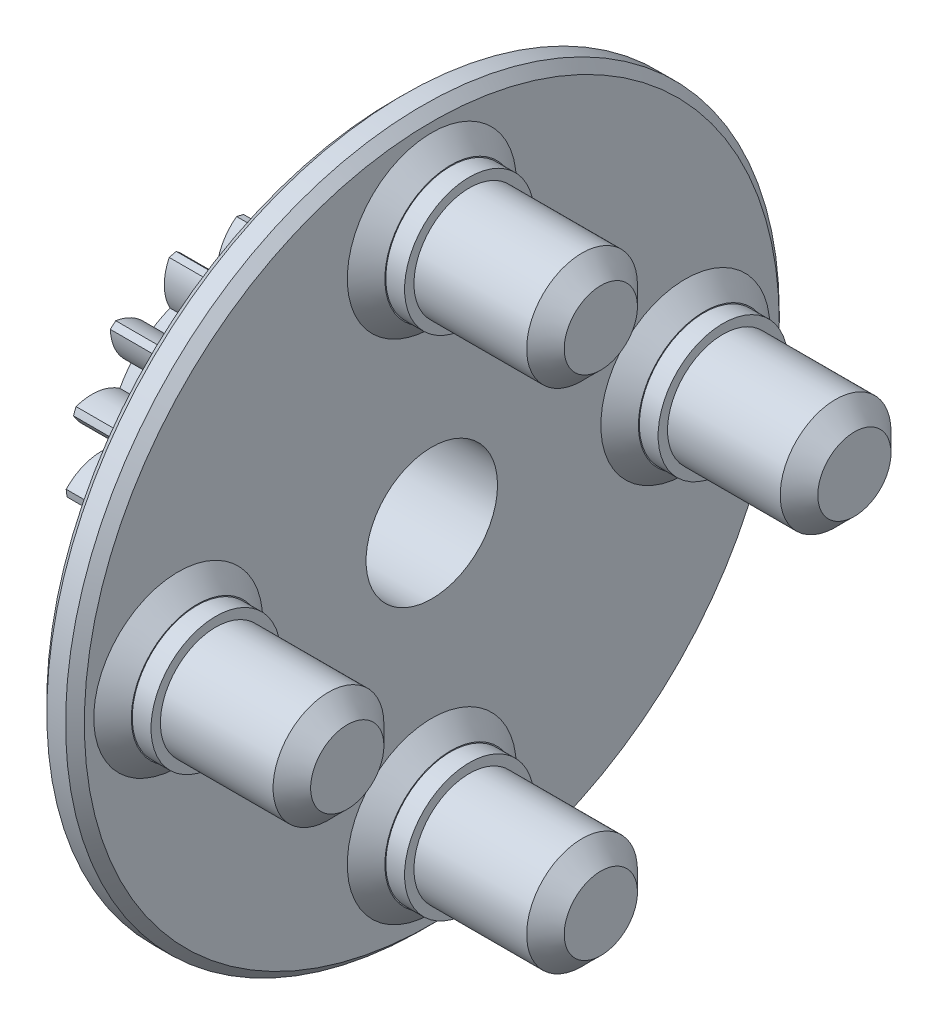
from build123d import *

# Parameters (mm, degrees)
BOSS_EXTRUDE1_OUTLINE_R   = 19
BOSS_EXTRUDE1_DEPTH       = 2
BOSS_EXTRUDE1_START       = -8
BOSS_EXTRUDE1_2_OUTLINE_R = 2.5
BOSS_EXTRUDE1_2_DEPTH     = 8
SKETCH2_R                 = 3.5
CUT_EXTRUDE1_DEPTH        = 29.670542374
SKETCH3_R                 = 2.95
BOSS_EXTRUDE2_DEPTH       = 9
BOSS_EXTRUDE3_START       = 2
SKETCH5_R                 = 3.5
BOSS_EXTRUDE3_DEPTH       = 2
SKETCH6_R                 = 4.5
BOSS_EXTRUDE4_DEPTH       = 1
SKETCH7_R                 = 3.45
BOSS_EXTRUDE5_DEPTH       = 1
CHAMFER3_SIZE             = 1
CHAMFER4_SIZE             = 1
CHAMFER5_SIZE             = 0.5
SKETCH8_R                 = 3.065
BOSS_EXTRUDE6_DEPTH       = 1
CHAMFER7_SIZE             = 0.1
CUT_EXTRUDE2_START        = -5
SKETCH9_R                 = 3.929046374
SKETCH9_R_2               = 2.95
CUT_EXTRUDE2_DEPTH        = 5


with BuildPart() as part:
    # Boss-Extrude1: read off the stored shape, not the designer's step
    # Boss-Extrude1 outline → Boss-Extrude1 (new body)
    with BuildSketch(Plane(origin=(8, 0, 0), x_dir=(0, 0, -1), z_dir=(1, 0, 0))):
        Circle(BOSS_EXTRUDE1_OUTLINE_R)
    extrude(amount=BOSS_EXTRUDE1_DEPTH)

    # Boss-Extrude1 2 outline → Boss-Extrude1 2 (add)
    with BuildSketch(Plane(origin=(8, 0, 0), x_dir=(0, 0, -1), z_dir=(1, 0, 0)).offset(BOSS_EXTRUDE1_START)):
        with BuildLine():
            ThreePointArc((-4.827976462, 5.739393982), (-4.973419937, 5.613830611), (-5.115599083, 5.484582575))
            ThreePointArc((-5.115599083, 5.484582575), (-4.796933675, 4.315856884), (-3.983306334, 3.41837266))
            ThreePointArc((-3.983306334, 3.41837266), (-4.319842312, 2.981771856), (-4.608733854, 2.512284471))
            ThreePointArc((-4.608733854, 2.512284471), (-5.736412412, 2.954786958), (-6.942190227, 2.838308449))
            ThreePointArc((-6.942190227, 2.838308449), (-7.01262182, 2.659536653), (-7.078450644, 2.479019256))
            ThreePointArc((-7.078450644, 2.479019256), (-6.253152528, 1.592255251), (-5.115639582, 1.175683915))
            ThreePointArc((-5.115639582, 1.175683915), (-5.21072888, 0.632697034), (-5.24834797, 0.082732007))
            ThreePointArc((-5.24834797, 0.082732007), (-6.452498904, -0.049509856), (-7.466031873, -0.712999344))
            ThreePointArc((-7.466031873, -0.712999344), (-7.445316556, -0.904025102), (-7.419714468, -1.094457498))
            ThreePointArc((-7.419714468, -1.094457498), (-6.276849497, -1.496112872), (-5.076041451, -1.336339847))
            ThreePointArc((-5.076041451, -1.336339847), (-4.907900258, -1.861321052), (-4.685628816, -2.365773362))
            ThreePointArc((-4.685628816, -2.365773362), (-5.690395658, -3.042464558), (-6.279495593, -4.10096758))
            ThreePointArc((-6.279495593, -4.10096758), (-6.172378994, -4.2604856), (-6.061211124, -4.41720723))
            ThreePointArc((-6.061211124, -4.41720723), (-4.862595889, -4.241739566), (-3.873583397, -3.542224254))
            ThreePointArc((-3.873583397, -3.542224254), (-3.480730833, -3.928932917), (-3.049488568, -4.272308565))
            ThreePointArc((-3.049488568, -4.272308565), (-3.624691343, -5.338427296), (-3.654402549, -6.549453566))
            ThreePointArc((-3.654402549, -6.549453566), (-3.48542379, -6.640920192), (-3.314157357, -6.728028018))
            ThreePointArc((-3.314157357, -6.728028018), (-2.334380164, -6.015634844), (-1.783734068, -4.936627773))
            ThreePointArc((-1.783734068, -4.936627773), (-1.256167922, -5.0964736), (-0.714747239, -5.200109363))
            ThreePointArc((-0.714747239, -5.200109363), (-0.728613924, -6.411420676), (-0.192129921, -7.497538669))
            ThreePointArc((-0.192129921, -7.497538669), (0, -7.5), (0.192129921, -7.497538669))
            ThreePointArc((0.192129921, -7.497538669), (0.728613924, -6.411420676), (0.714747239, -5.200109363))
            ThreePointArc((0.714747239, -5.200109363), (1.256167922, -5.0964736), (1.783734068, -4.936627773))
            ThreePointArc((1.783734068, -4.936627773), (2.334380164, -6.015634844), (3.314157357, -6.728028018))
            ThreePointArc((3.314157357, -6.728028018), (3.48542379, -6.640920192), (3.654402549, -6.549453566))
            ThreePointArc((3.654402549, -6.549453566), (3.624691343, -5.338427296), (3.049488568, -4.272308565))
            ThreePointArc((3.049488568, -4.272308565), (3.480730833, -3.928932917), (3.873583397, -3.542224254))
            ThreePointArc((3.873583397, -3.542224254), (4.862595889, -4.241739566), (6.061211124, -4.41720723))
            ThreePointArc((6.061211124, -4.41720723), (6.172378994, -4.2604856), (6.279495593, -4.10096758))
            ThreePointArc((6.279495593, -4.10096758), (5.690395658, -3.042464558), (4.685628816, -2.365773362))
            ThreePointArc((4.685628816, -2.365773362), (4.907900258, -1.861321052), (5.076041451, -1.336339847))
            ThreePointArc((5.076041451, -1.336339847), (6.276849497, -1.496112872), (7.419714468, -1.094457498))
            ThreePointArc((7.419714468, -1.094457498), (7.445316556, -0.904025102), (7.466031873, -0.712999344))
            ThreePointArc((7.466031873, -0.712999344), (6.452498904, -0.049509856), (5.24834797, 0.082732007))
            ThreePointArc((5.24834797, 0.082732007), (5.21072888, 0.632697034), (5.115639582, 1.175683915))
            ThreePointArc((5.115639582, 1.175683915), (6.253152528, 1.592255251), (7.078450644, 2.479019256))
            ThreePointArc((7.078450644, 2.479019256), (7.01262182, 2.659536653), (6.942190227, 2.838308449))
            ThreePointArc((6.942190227, 2.838308449), (5.736412412, 2.954786958), (4.608733854, 2.512284471))
            ThreePointArc((4.608733854, 2.512284471), (4.319842312, 2.981771856), (3.983306334, 3.41837266))
            ThreePointArc((3.983306334, 3.41837266), (4.796933675, 4.315856884), (5.115599083, 5.484582575))
            ThreePointArc((5.115599083, 5.484582575), (4.973419937, 5.613830611), (4.827976462, 5.739393982))
            ThreePointArc((4.827976462, 5.739393982), (3.706182968, 5.282177689), (2.913314353, 4.366302839))
            ThreePointArc((2.913314353, 4.366302839), (2.43933193, 4.647758679), (1.93844561, 4.877953425))
            ThreePointArc((1.93844561, 4.877953425), (2.241795126, 6.050747718), (1.980825421, 7.233694122))
            ThreePointArc((1.980825421, 7.233694122), (1.794867482, 7.282063631), (1.607731473, 7.325653521))
            ThreePointArc((1.607731473, 7.325653521), (0.82691167, 6.399485168), (0.550489643, 5.220053846))
            ThreePointArc((0.550489643, 5.220053846), (0, 5.249), (-0.550489643, 5.220053846))
            ThreePointArc((-0.550489643, 5.220053846), (-0.82691167, 6.399485168), (-1.607731473, 7.325653521))
            ThreePointArc((-1.607731473, 7.325653521), (-1.794867482, 7.282063631), (-1.980825421, 7.233694122))
            ThreePointArc((-1.980825421, 7.233694122), (-2.241795126, 6.050747718), (-1.93844561, 4.877953425))
            ThreePointArc((-1.93844561, 4.877953425), (-2.43933193, 4.647758679), (-2.913314353, 4.366302839))
            ThreePointArc((-2.913314353, 4.366302839), (-3.706182968, 5.282177689), (-4.827976462, 5.739393982))
        make_face()
        Circle(BOSS_EXTRUDE1_2_OUTLINE_R, mode=Mode.SUBTRACT)
    extrude(amount=BOSS_EXTRUDE1_2_DEPTH)

    # Sketch2 → Cut-Extrude1 (cut, through all)
    with BuildSketch(Plane(origin=(10, 0, 0), x_dir=(0, 0, -1), z_dir=(1, 0, 0))):
        Circle(SKETCH2_R)
    extrude(amount=-CUT_EXTRUDE1_DEPTH, mode=Mode.SUBTRACT)

    # Sketch3 → Boss-Extrude2 (add)
    with BuildSketch(Plane(origin=(10, 0, 0), x_dir=(0, 0, -1), z_dir=(1, 0, 0))):
        with Locations((-13.5, 0)):
            Circle(SKETCH3_R)
        with Locations((0, 13.5)):
            Circle(SKETCH3_R)
        with Locations((13.5, 0)):
            Circle(SKETCH3_R)
        with Locations((0, -13.5)):
            Circle(SKETCH3_R)
    extrude(amount=BOSS_EXTRUDE2_DEPTH)

    # Sketch5 → Boss-Extrude3 (add)
    with BuildSketch(Plane.ZY.offset(BOSS_EXTRUDE3_START)):
        with BuildLine():
            ThreePointArc((3.983306334, 3.41837266), (4.796933675, 4.315856884), (5.115599083, 5.484582575))
            ThreePointArc((5.115599083, 5.484582575), (4.973419937, 5.613830611), (4.827976462, 5.739393982))
            ThreePointArc((4.827976462, 5.739393982), (3.706182968, 5.282177689), (2.913314353, 4.366302839))
            ThreePointArc((2.913314353, 4.366302839), (2.43933193, 4.647758679), (1.93844561, 4.877953425))
            ThreePointArc((1.93844561, 4.877953425), (2.241795126, 6.050747718), (1.980825421, 7.233694122))
            ThreePointArc((1.980825421, 7.233694122), (1.794867482, 7.282063631), (1.607731473, 7.325653521))
            ThreePointArc((1.607731473, 7.325653521), (0.82691167, 6.399485168), (0.550489643, 5.220053846))
            ThreePointArc((0.550489643, 5.220053846), (0, 5.249), (-0.550489643, 5.220053846))
            ThreePointArc((-0.550489643, 5.220053846), (-0.82691167, 6.399485168), (-1.607731473, 7.325653521))
            ThreePointArc((-1.607731473, 7.325653521), (-1.794867482, 7.282063631), (-1.980825421, 7.233694122))
            ThreePointArc((-1.980825421, 7.233694122), (-2.241795126, 6.050747718), (-1.93844561, 4.877953425))
            ThreePointArc((-1.93844561, 4.877953425), (-2.43933193, 4.647758679), (-2.913314353, 4.366302839))
            ThreePointArc((-2.913314353, 4.366302839), (-3.706182968, 5.282177689), (-4.827976462, 5.739393982))
            ThreePointArc((-4.827976462, 5.739393982), (-4.973419937, 5.613830611), (-5.115599083, 5.484582575))
            ThreePointArc((-5.115599083, 5.484582575), (-4.796933675, 4.315856884), (-3.983306334, 3.41837266))
            ThreePointArc((-3.983306334, 3.41837266), (-4.319842312, 2.981771856), (-4.608733854, 2.512284471))
            ThreePointArc((-4.608733854, 2.512284471), (-5.736412412, 2.954786958), (-6.942190227, 2.838308449))
            ThreePointArc((-6.942190227, 2.838308449), (-7.01262182, 2.659536653), (-7.078450644, 2.479019256))
            ThreePointArc((-7.078450644, 2.479019256), (-6.253152529, 1.592255251), (-5.115639582, 1.175683915))
            ThreePointArc((-5.115639582, 1.175683915), (-5.21072888, 0.632697035), (-5.24834797, 0.082732007))
            ThreePointArc((-5.24834797, 0.082732007), (-6.452498904, -0.049509856), (-7.466031873, -0.712999344))
            ThreePointArc((-7.466031873, -0.712999344), (-7.445316556, -0.904025102), (-7.419714468, -1.094457498))
            ThreePointArc((-7.419714468, -1.094457498), (-6.276849497, -1.496112872), (-5.076041451, -1.336339847))
            ThreePointArc((-5.076041451, -1.336339847), (-4.907900258, -1.861321052), (-4.685628816, -2.365773362))
            ThreePointArc((-4.685628816, -2.365773362), (-5.690395658, -3.042464558), (-6.279495593, -4.10096758))
            ThreePointArc((-6.279495593, -4.10096758), (-6.172378994, -4.2604856), (-6.061211124, -4.41720723))
            ThreePointArc((-6.061211124, -4.41720723), (-4.862595889, -4.241739566), (-3.873583397, -3.542224254))
            ThreePointArc((-3.873583397, -3.542224254), (-3.480730833, -3.928932917), (-3.049488568, -4.272308565))
            ThreePointArc((-3.049488568, -4.272308565), (-3.624691343, -5.338427296), (-3.654402549, -6.549453566))
            ThreePointArc((-3.654402549, -6.549453566), (-3.48542379, -6.640920192), (-3.314157357, -6.728028018))
            ThreePointArc((-3.314157357, -6.728028018), (-2.334380164, -6.015634844), (-1.783734068, -4.936627773))
            ThreePointArc((-1.783734068, -4.936627773), (-1.256167922, -5.0964736), (-0.714747239, -5.200109363))
            ThreePointArc((-0.714747239, -5.200109363), (-0.728613924, -6.411420676), (-0.192129921, -7.497538669))
            ThreePointArc((-0.192129921, -7.497538669), (0, -7.5), (0.192129921, -7.497538669))
            ThreePointArc((0.192129921, -7.497538669), (0.728613924, -6.411420676), (0.714747239, -5.200109363))
            ThreePointArc((0.714747239, -5.200109363), (1.256167922, -5.0964736), (1.783734068, -4.936627773))
            ThreePointArc((1.783734068, -4.936627773), (2.334380164, -6.015634844), (3.314157357, -6.728028018))
            ThreePointArc((3.314157357, -6.728028018), (3.48542379, -6.640920192), (3.654402549, -6.549453566))
            ThreePointArc((3.654402549, -6.549453566), (3.624691343, -5.338427296), (3.049488568, -4.272308565))
            ThreePointArc((3.049488568, -4.272308565), (3.480730833, -3.928932917), (3.873583397, -3.542224254))
            ThreePointArc((3.873583397, -3.542224254), (4.862595889, -4.241739566), (6.061211124, -4.41720723))
            ThreePointArc((6.061211124, -4.41720723), (6.172378994, -4.2604856), (6.279495593, -4.10096758))
            ThreePointArc((6.279495593, -4.10096758), (5.690395658, -3.042464558), (4.685628816, -2.365773362))
            ThreePointArc((4.685628816, -2.365773362), (4.907900258, -1.861321052), (5.076041451, -1.336339847))
            ThreePointArc((5.076041451, -1.336339847), (6.276849497, -1.496112872), (7.419714468, -1.094457498))
            ThreePointArc((7.419714468, -1.094457498), (7.445316556, -0.904025102), (7.466031873, -0.712999344))
            ThreePointArc((7.466031873, -0.712999344), (6.452498904, -0.049509856), (5.24834797, 0.082732007))
            ThreePointArc((5.24834797, 0.082732007), (5.21072888, 0.632697035), (5.115639582, 1.175683915))
            ThreePointArc((5.115639582, 1.175683915), (6.253152529, 1.592255251), (7.078450644, 2.479019256))
            ThreePointArc((7.078450644, 2.479019256), (7.01262182, 2.659536653), (6.942190227, 2.838308449))
            ThreePointArc((6.942190227, 2.838308449), (5.736412412, 2.954786958), (4.608733854, 2.512284471))
            ThreePointArc((4.608733854, 2.512284471), (4.319842312, 2.981771856), (3.983306334, 3.41837266))
        make_face()
        with Locations(Location((0, 0, 0), (0, 0, 180))):
            Circle(SKETCH5_R, mode=Mode.SUBTRACT)
    extrude(amount=-BOSS_EXTRUDE3_DEPTH)

    # Sketch6 → Boss-Extrude4 (add)
    with BuildSketch(Plane(origin=(10, 0, 0), x_dir=(0, 0, -1), z_dir=(1, 0, 0))):
        with Locations((-13.5, 0)):
            Circle(SKETCH6_R)
        with Locations((0, 13.5)):
            Circle(SKETCH6_R)
        with Locations((13.5, 0)):
            Circle(SKETCH6_R)
        with Locations((0, -13.5)):
            Circle(SKETCH6_R)
    extrude(amount=BOSS_EXTRUDE4_DEPTH)

    # Sketch7 → Boss-Extrude5 (add)
    with BuildSketch(Plane(origin=(11, 0, 0), x_dir=(0, 0, -1), z_dir=(1, 0, 0))):
        with Locations((-13.5, 0)):
            Circle(SKETCH7_R)
        with Locations((0, 13.5)):
            Circle(SKETCH7_R)
        with Locations((13.5, 0)):
            Circle(SKETCH7_R)
        with Locations((0, -13.5)):
            Circle(SKETCH7_R)
    extrude(amount=BOSS_EXTRUDE5_DEPTH)

    # Chamfer3
    chamfer3_edges = [part.edges().sort_by_distance(p)[0] for p in [
        (11, 0, 18),
        (11, 13.5, 4.5),
        (11, 0, -9),
        (11, -13.5, 4.5),
    ]]
    chamfer(chamfer3_edges, length=CHAMFER3_SIZE - 0.0001)  # a hair under: the kernel refuses the full size

    # Chamfer4
    chamfer4_edges = [part.edges().sort_by_distance(p)[0] for p in [
        (19, 0, 16.45),
        (19, 13.5, 2.95),
        (19, 0, -10.55),
        (19, -13.5, 2.95),
    ]]
    chamfer(chamfer4_edges, length=CHAMFER4_SIZE)

    # Chamfer5
    chamfer5_edges = [part.edges().sort_by_distance(p)[0] for p in [
        (8, 0, 19),
        (10, 0, 19),
    ]]
    chamfer(chamfer5_edges, length=CHAMFER5_SIZE)

    # Sketch8 → Boss-Extrude6 (add)
    with BuildSketch(Plane(origin=(15, 0, 0), x_dir=(0, 0, -1), z_dir=(1, 0, 0))):
        with Locations((0, 13.5)):
            Circle(SKETCH8_R)
        with Locations((13.5, 0)):
            Circle(SKETCH8_R)
        with Locations((0, -13.5)):
            Circle(SKETCH8_R)
        with Locations((-13.5, 0)):
            Circle(SKETCH8_R)
    extrude(amount=BOSS_EXTRUDE6_DEPTH)

    # Chamfer7
    chamfer7_edges = [part.edges().sort_by_distance(p)[0] for p in [
        (16, 13.5, 3.065),
        (16, 0, -10.435),
        (16, -13.5, 3.065),
        (16, 0, 16.565),
    ]]
    chamfer(chamfer7_edges, length=CHAMFER7_SIZE)

    # Sketch9 → Cut-Extrude2 (cut)
    # profile 1 of 4: a face of its own
    with BuildSketch(Plane(origin=(19, 0, 0), x_dir=(0, 0, -1), z_dir=(1, 0, 0)).offset(CUT_EXTRUDE2_START)):
        with Locations((-13.5, 0)):
            Circle(SKETCH9_R)
        with Locations((-13.5, 0)):
            Circle(SKETCH9_R_2, mode=Mode.SUBTRACT)
    # profile 2 of 4: a face of its own
    with BuildSketch(Plane(origin=(19, 0, 0), x_dir=(0, 0, -1), z_dir=(1, 0, 0)).offset(CUT_EXTRUDE2_START)):
        with Locations((0, 13.5)):
            Circle(SKETCH9_R)
        with Locations((0, 13.5)):
            Circle(SKETCH9_R_2, mode=Mode.SUBTRACT)
    # profile 3 of 4: a face of its own
    with BuildSketch(Plane(origin=(19, 0, 0), x_dir=(0, 0, -1), z_dir=(1, 0, 0)).offset(CUT_EXTRUDE2_START)):
        with Locations((13.5, 0)):
            Circle(SKETCH9_R)
        with Locations((13.5, 0)):
            Circle(SKETCH9_R_2, mode=Mode.SUBTRACT)
    # profile 4 of 4: a face of its own
    with BuildSketch(Plane(origin=(19, 0, 0), x_dir=(0, 0, -1), z_dir=(1, 0, 0)).offset(CUT_EXTRUDE2_START)):
        with Locations((0, -13.5)):
            Circle(SKETCH9_R)
        with Locations((0, -13.5)):
            Circle(SKETCH9_R_2, mode=Mode.SUBTRACT)
    extrude(amount=CUT_EXTRUDE2_DEPTH, mode=Mode.SUBTRACT)


solid = part.part
